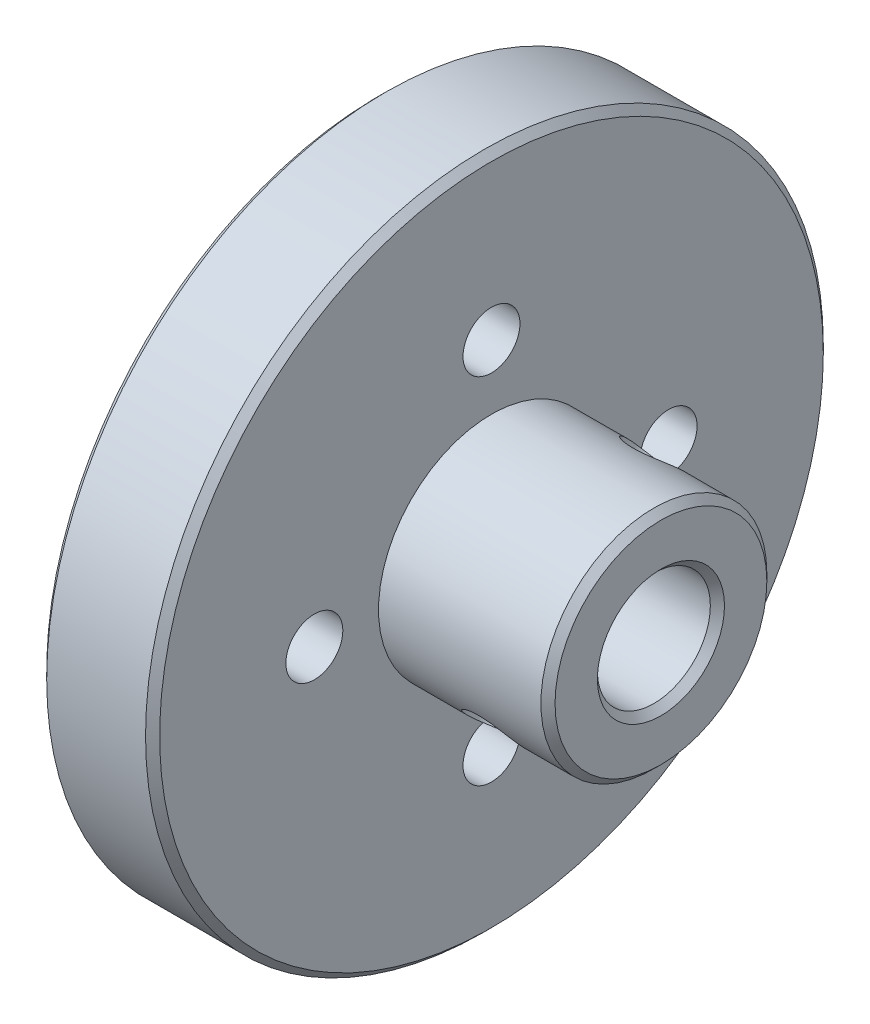
from build123d import *

# Parameters (mm, degrees)
PIN_CUT_DEPTH      = 32.270123521
PIN_CUT_DEPTH_BACK = 32.270123521
SKETCH3_R          = 1.63195
SKETCH2_R          = 1.6
CUT_EXTRUDE2_DEPTH = 32.270123571
CHAMFER1_SIZE      = 0.396875


with BuildPart() as part:
    # Sketch1 → Revolve1 (revolve)
    with BuildSketch(Plane.XY):
        Polygon((0, 3.175), (0, 6.35), (-9.525, 6.35), (-9.525, 19.05), (-15.875, 19.05), (-15.875, 4.5), (-14.0716, 4.5), (-14.0716, 3.175), align=None)
    revolve(axis=Axis((0, 0, 0), (-1, 0, 0)))

    # Sketch3 → Pin Cut (cut, two sides: drawn at the far end of the back side and taken through both)
    with BuildSketch(Plane(origin=(0, 0, 0), x_dir=(1, 0, 0), z_dir=(0, 0.7071067811865464, -0.7071067811865488)).offset(-PIN_CUT_DEPTH_BACK)):
        with Locations((-4.7625, 0)):
            Circle(SKETCH3_R)
    extrude(amount=PIN_CUT_DEPTH + PIN_CUT_DEPTH_BACK, mode=Mode.SUBTRACT)

    # Sketch2 → Cut-Extrude2 (cut, through all)
    with BuildSketch(Plane.ZY.offset(15.875)):
        with Locations((-9.9568, 0)):
            Circle(SKETCH2_R)
        with Locations((0, 9.9568)):
            Circle(SKETCH2_R)
        with Locations((9.9568, 0)):
            Circle(SKETCH2_R)
        with Locations((0, -9.9568)):
            Circle(SKETCH2_R)
    extrude(amount=-CUT_EXTRUDE2_DEPTH, mode=Mode.SUBTRACT)

    # Chamfer1
    chamfer1_edges = [part.edges().sort_by_distance(p)[0] for p in [
        (0, -3.175, 0),
        (0, -6.35, 0),
        (-9.525, -19.05, 0),
        (-15.875, -19.05, 0),
    ]]
    chamfer(chamfer1_edges, length=CHAMFER1_SIZE)


solid = part.part
